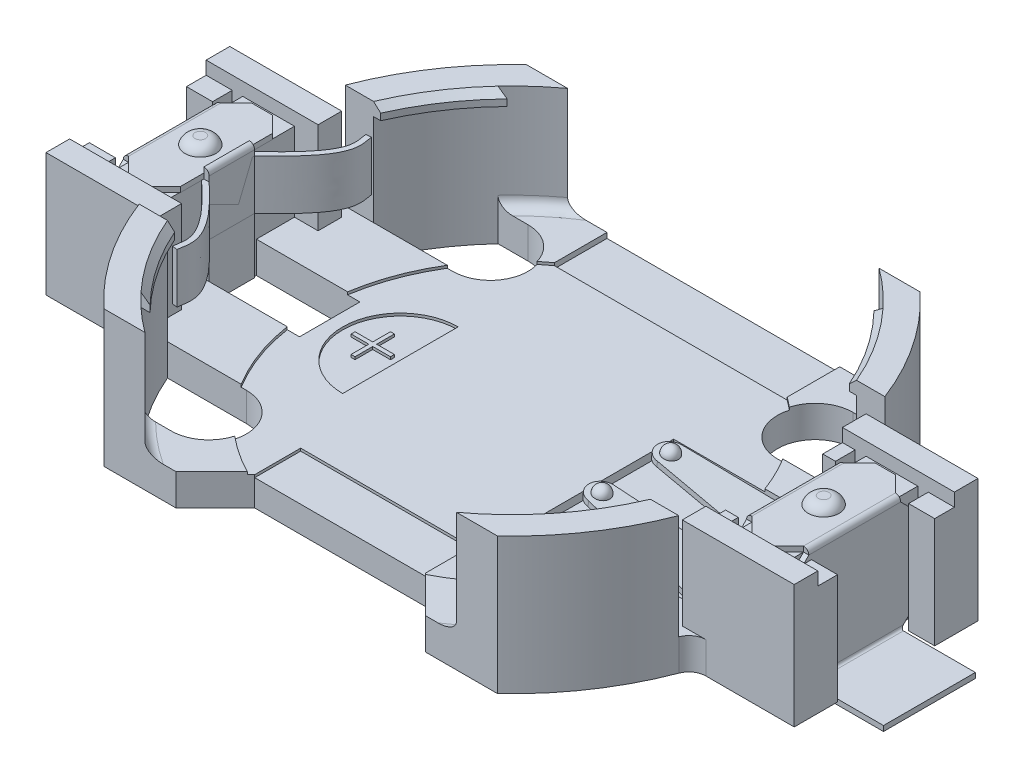
from build123d import *
from build123d.topology import SkipClean

# Parameters (mm, degrees)
EXTRUDE1_DEPTH           = 5.2
FILLET1_R                = 0.65
SKETCH2_R                = 10
CUT_EXTRUDE1_DEPTH       = 3.5
SKETCH3_R                = 9.75
CUT_EXTRUDE2_DEPTH       = 0.5
CHAMFER1_SIZE            = 0.25
FILLET2_R                = 0.4
CUT_EXTRUDE3_START       = -0.5
SKETCH4_W                = 29.959349594
SKETCH4_H                = 7.85
CUT_EXTRUDE3_DEPTH       = 0.5
CUT_EXTRUDE4_DEPTH       = 3.5
CUT_EXTRUDE5_DEPTH       = 4.7
SKETCH7_R                = 7.5
CUT_EXTRUDE6_DEPTH       = 0.1
CUT_EXTRUDE7_DEPTH       = 0.1
CUT_EXTRUDE7_DEPTH_BACK  = 0.1
SKETCH8_W                = 6.5
SKETCH8_H                = 1.75
SKETCH8_W_2              = 8.865100112
SKETCH8_H_2              = 2
SKETCH9_W                = 28.5
SKETCH9_H                = 5.2
CUT_EXTRUDE8_DEPTH       = 0.5
CUT_EXTRUDE9_START       = -4.2
CUT_EXTRUDE9_OUTLINE_W   = 3.942434783
CUT_EXTRUDE9_OUTLINE_H   = 2.3
CUT_EXTRUDE9_DEPTH       = 4.2
SKETCH11_W               = 7.32885996
SKETCH11_H               = 5.2
CUT_EXTRUDE10_DEPTH      = 0.4
SKETCH12_R               = 0.6
EXTRUDE2_DEPTH           = 0.5
FILLET3_R                = 0.4
EXTRUDE_THIN1_DEPTH      = 1.75
EXTRUDE_THIN1_DEPTH_BACK = 1.75
SKETCH16_W               = 0.484271675
SKETCH16_H               = 0.75
EXTRUDE3_DEPTH           = 3.4
EXTRUDE4_DEPTH           = 0.2
EXTRUDE5_DEPTH           = 0.2
EXTRUDE6_DEPTH           = 0.2
EXTRUDE7_DEPTH           = 0.2
CUT_EXTRUDE11_DEPTH      = 0.2
SKETCH22_R               = 0.3
EXTRUDE8_DEPTH           = 0.3
FILLET4_R                = 0.3
EXTRUDE9_DEPTH           = 0.2
EXTRUDE_THIN2_DEPTH      = 1.75
EXTRUDE_THIN2_DEPTH_BACK = 1.75
EXTRUDE_THIN3_START      = -1.9
EXTRUDE_THIN3_DEPTH      = 1.9
SKETCH26_W               = 1.729426848
SKETCH26_H               = 4.424427597
EXTRUDE10_DEPTH          = 0.2
EXTRUDE11_DEPTH          = 0.2
FILLET5_R                = 0.2
FILLET6_R                = 0.1
FILLET7_R                = 0.3


# Read off the part's stored shape, not the designer's step: Cut-Extrude9, Extrude-Thin3
# Some blends are built 0.0001 mm under size
with BuildPart() as part:
    # Sketch1 → Extrude1 (new body)
    with BuildSketch(Plane(origin=(0, 0, 0), x_dir=(1, 0, 0), z_dir=(0, 1, 0))):
        with BuildLine():
            Line((14.25, 3.5), (10.428326807, 3.5))
            ThreePointArc((10.428326807, 3.5), (9.246646511, 5.95814806), (7.496499183, 8.05))
            Line((7.496499183, 8.05), (-7.496499183, 8.05))
            ThreePointArc((-7.496499183, 8.05), (-9.246646511, 5.95814806), (-10.428326807, 3.5))
            Line((-10.428326807, 3.5), (-14.25, 3.5))
            Line((-14.25, 3.5), (-14.25, -3.5))
            Line((-14.25, -3.5), (-10.428326807, -3.5))
            ThreePointArc((-10.428326807, -3.5), (-9.246646511, -5.95814806), (-7.496499183, -8.05))
            Line((-7.496499183, -8.05), (-4.75, -8.05))
            Line((-4.75, -8.05), (-3.25, -6.55))
            Line((-3.25, -6.55), (3.25, -6.55))
            Line((3.25, -6.55), (4.75, -8.05))
            Line((4.75, -8.05), (7.496499183, -8.05))
            ThreePointArc((7.496499183, -8.05), (9.246646511, -5.95814806), (10.428326807, -3.5))
            Line((10.428326807, -3.5), (14.25, -3.5))
            Line((14.25, -3.5), (14.25, 3.5))
        make_face()
    extrude(amount=EXTRUDE1_DEPTH)

    # Fillet1
    fillet1_edges = [part.edges().sort_by_distance(p)[0] for p in [
        (-10.428326807, 2.6, 3.5),
        (-10.428326807, 2.6, -3.5),
        (10.428326807, 2.6, -3.5),
        (10.428326807, 2.6, 3.5),
    ]]
    fillet(fillet1_edges, radius=FILLET1_R)

    # Sketch2 → Cut-Extrude1 (cut)
    with BuildSketch(Plane(origin=(0, 1.2, 0), x_dir=(-1, 0, 0), z_dir=(0, 1, 0))):
        Circle(SKETCH2_R)
    extrude(amount=CUT_EXTRUDE1_DEPTH, mode=Mode.SUBTRACT)

    # Sketch3 → Cut-Extrude2 (cut)
    with BuildSketch(Plane(origin=(0, 5.2, 0), x_dir=(-1, 0, 0), z_dir=(0, 1, 0))):
        Circle(SKETCH3_R)
    extrude(amount=-CUT_EXTRUDE2_DEPTH, mode=Mode.SUBTRACT)

    # Chamfer1
    chamfer1_edges = [part.edges().sort_by_distance(p)[0] for p in [
        (-9.75, 5.2, 0),
        (9.75, 5.2, 0),
    ]]
    chamfer(chamfer1_edges, length=CHAMFER1_SIZE)

    # Fillet2
    fillet2_edges = [part.edges().sort_by_distance(p)[0] for p in [
        (10, 1.2, 0),
        (-10, 1.2, 0),
    ]]
    fillet(fillet2_edges, radius=FILLET2_R)

    # Sketch4 → Cut-Extrude3 (cut)
    with SkipClean():  # the faces are left unmerged after this step: merging them gives an invalid solid
        with BuildSketch(Plane(origin=(0, 5.2, 0), x_dir=(-1, 0, 0), z_dir=(0, 1, 0)).offset(CUT_EXTRUDE3_START)):
            with BuildLine():
                Line((5.932748098, 8.05), (-5.932748098, 8.05))
                ThreePointArc((-5.932748098, 8.05), (-6.661817604, 7.457894221), (-7.332121112, 6.8))
                Line((-7.332121112, 6.8), (7.332121112, 6.8))
                ThreePointArc((7.332121112, 6.8), (6.661817604, 7.457894221), (5.932748098, 8.05))
            make_face()
            with Locations((0.081300813, 0)):
                Rectangle(SKETCH4_W, SKETCH4_H)
            with BuildLine():
                Line((5.932748098, -8.05), (-5.932748098, -8.05))
                ThreePointArc((-5.932748098, -8.05), (-6.661817604, -7.457894221), (-7.332121112, -6.8))
                Line((-7.332121112, -6.8), (7.332121112, -6.8))
                ThreePointArc((7.332121112, -6.8), (6.661817604, -7.457894221), (5.932748098, -8.05))
            make_face()
        extrude(amount=CUT_EXTRUDE3_DEPTH, mode=Mode.SUBTRACT)

    # Sketch5 → Cut-Extrude4 (cut)
    with BuildSketch(Plane(origin=(0, 4.7, 0), x_dir=(-1, 0, 0), z_dir=(0, 1, 0))):
        Polygon((-10.885770529, 3.5), (-10.275912368, 3.925), (-8.925070028, 3.925), (8.925070028, 3.925), (10.275912368, 3.925), (10.885770529, 3.5), (9.985770529, 3.5), (9.985770529, 2.6), (10.885770529, 2.6), (10.885770529, -2.6), (9.985770529, -2.6), (9.985770529, -3.5), (10.885770529, -3.5), (10.275912368, -3.925), (8.925070028, -3.925), (-8.925070028, -3.925), (-10.275912368, -3.925), (-10.885770529, -3.5), (-9.985770529, -3.5), (-9.985770529, -2.6), (-10.885770529, -2.6), (-10.885770529, 2.6), (-9.985770529, 2.6), (-9.985770529, 3.5), align=None)
    extrude(amount=-CUT_EXTRUDE4_DEPTH, mode=Mode.SUBTRACT)

    # Sketch6 → Cut-Extrude5 (cut)
    with BuildSketch(Plane(origin=(0, 0, 0), x_dir=(1, 0, 0), z_dir=(0, 1, 0))):
        with BuildLine():
            Line((-7.332121112, -6.8), (-6.186989126, -6.8))
            ThreePointArc((-6.186989126, -6.8), (-4.749489126, -5.3625), (-6.186989126, -3.925))
            Line((-6.186989126, -3.925), (-9.197520046, -3.925))
            ThreePointArc((-9.197520046, -3.925), (-8.388901326, -5.443007858), (-7.332121112, -6.8))
        make_face()
        with BuildLine():
            Line((-7.332121112, 6.8), (-6.186989126, 6.8))
            ThreePointArc((-6.186989126, 6.8), (-4.749489126, 5.3625), (-6.186989126, 3.925))
            Line((-6.186989126, 3.925), (-9.197520046, 3.925))
            ThreePointArc((-9.197520046, 3.925), (-8.388901326, 5.443007858), (-7.332121112, 6.8))
        make_face()
        with BuildLine():
            Line((6.186989126, 3.925), (9.197520046, 3.925))
            ThreePointArc((9.197520046, 3.925), (8.388901326, 5.443007858), (7.332121112, 6.8))
            Line((7.332121112, 6.8), (6.186989126, 6.8))
            ThreePointArc((6.186989126, 6.8), (4.749489126, 5.3625), (6.186989126, 3.925))
        make_face()
        with BuildLine():
            Line((6.186989126, -3.925), (9.197520046, -3.925))
            ThreePointArc((9.197520046, -3.925), (8.388901326, -5.443007858), (7.332121112, -6.8))
            Line((7.332121112, -6.8), (6.186989126, -6.8))
            ThreePointArc((6.186989126, -6.8), (4.749489126, -5.3625), (6.186989126, -3.925))
        make_face()
    extrude(amount=CUT_EXTRUDE5_DEPTH, mode=Mode.SUBTRACT)

    # Sketch7 → Cut-Extrude6 (cut)
    with BuildSketch(Plane(origin=(0, 1.2, 0), x_dir=(-1, 0, 0), z_dir=(0, 1, 0))):
        Circle(SKETCH7_R)
    extrude(amount=-CUT_EXTRUDE6_DEPTH, mode=Mode.SUBTRACT)

    # Sketch8 → Cut-Extrude7 (cut, two sides: drawn at the far end of the back side and taken through both)
    # profile 1 of 3: a face of its own
    with BuildSketch(Plane(origin=(0, 1.1, 0), x_dir=(-1, 0, 0), z_dir=(0, 1, 0)).offset(-CUT_EXTRUDE7_DEPTH_BACK)):
        with Locations((0, 5.675)):
            Rectangle(SKETCH8_W, SKETCH8_H)
    # profile 2 of 3: a face of its own
    with BuildSketch(Plane(origin=(0, 1.1, 0), x_dir=(-1, 0, 0), z_dir=(0, 1, 0)).offset(-CUT_EXTRUDE7_DEPTH_BACK)):
        with Locations((0, -7.05)):
            Rectangle(SKETCH8_W_2, SKETCH8_H_2)
    # profile 3 of 3: a face of its own
    with BuildSketch(Plane(origin=(0, 1.1, 0), x_dir=(-1, 0, 0), z_dir=(0, 1, 0)).offset(-CUT_EXTRUDE7_DEPTH_BACK)):
        with BuildLine():
            Line((4.25, -2.2), (4.25, 2.2))
            ThreePointArc((4.25, 2.2), (6.45, 0), (4.25, -2.2))
        make_face()
        Polygon((5.380281096, 0.075), (5.380281096, 0.75), (5.230281096, 0.75), (5.230281096, 0.075), (4.552474472, 0.075), (4.552474472, -0.075), (5.230281096, -0.075), (5.230281096, -0.75), (5.380281096, -0.75), (5.380281096, -0.075), (6.052474472, -0.075), (6.052474472, 0.075), align=None, mode=Mode.SUBTRACT)
    extrude(amount=CUT_EXTRUDE7_DEPTH + CUT_EXTRUDE7_DEPTH_BACK, mode=Mode.SUBTRACT)

    # Sketch9 → Cut-Extrude8 (cut)
    with BuildSketch(Plane(origin=(0, 4.7, 0), x_dir=(-1, 0, 0), z_dir=(0, 1, 0))):
        Rectangle(SKETCH9_W, SKETCH9_H)
    extrude(amount=-CUT_EXTRUDE8_DEPTH, mode=Mode.SUBTRACT)

    # Cut-Extrude9 outline → Cut-Extrude9 (cut)
    with BuildSketch(Plane(origin=(0, 4.2, 0), x_dir=(-1, 0, 0), z_dir=(0, 1, 0)).offset(CUT_EXTRUDE9_START)):
        with Locations((8.914553138, 0)):
            Rectangle(CUT_EXTRUDE9_OUTLINE_W, CUT_EXTRUDE9_OUTLINE_H)
        Polygon((12.856094179, 2.6), (12.856094179, -2.6), (13.256094179, -2.6), (13.256094179, -1.85), (14.25, -1.85), (14.25, 1.85), (13.256094179, 1.85), (13.256094179, 2.6), align=None)
        Polygon((-12.856094179, -2.6), (-12.856094179, 2.6), (-13.256094179, 2.6), (-13.256094179, 1.85), (-14.25, 1.85), (-14.25, -1.85), (-13.256094179, -1.85), (-13.256094179, -2.6), align=None)
    extrude(amount=CUT_EXTRUDE9_DEPTH, mode=Mode.SUBTRACT)

    # Sketch11 → Cut-Extrude10 (cut)
    with BuildSketch(Plane(origin=(0, 1.2, 0), x_dir=(-1, 0, 0), z_dir=(0, 1, 0))):
        with Locations((-7.221340549, 0)):
            Rectangle(SKETCH11_W, SKETCH11_H)
    extrude(amount=-CUT_EXTRUDE10_DEPTH, mode=Mode.SUBTRACT)

    # Sketch12 → Extrude2 (add)
    with BuildSketch(Plane(origin=(0, 4.2, 0), x_dir=(-1, 0, 0), z_dir=(0, 1, 0))):
        with Locations(Location((11.870932354, 0, 0), (0, 0, 90))):
            Circle(SKETCH12_R)
        with Locations(Location((-11.870932354, 0, 0), (0, 0, 90))):
            Circle(SKETCH12_R)
    extrude(amount=EXTRUDE2_DEPTH)

    # Fillet3
    fillet3_edges = [part.edges().sort_by_distance(p)[0] for p in [
        (-11.870932354, 4.7, -0.6),
        (11.870932354, 4.7, -0.6),
    ]]
    fillet(fillet3_edges, radius=FILLET3_R)

    # Sketch14 → Extrude-Thin1 (add, two sides: drawn at the far end of the back side and taken through both)
    with BuildSketch(Plane.XY.offset(-EXTRUDE_THIN1_DEPTH_BACK)):
        Polygon((15.9, -0.2), (12.856094179, -0.2), (12.856094179, 4.2), (10.885770529, 4.2), (10.885770529, 0.8), (4.214275881, 1.725231959), (4.241749803, 1.923335931), (10.685770529, 1.029651047), (10.685770529, 4.4), (13.056094179, 4.4), (13.056094179, 0), (15.9, 0), align=None)
    extrude(amount=EXTRUDE_THIN1_DEPTH + EXTRUDE_THIN1_DEPTH_BACK)

    # Sketch16 → Extrude3 (add)
    with BuildSketch(Plane(origin=(0, 4.2, 0), x_dir=(-1, 0, 0), z_dir=(0, 1, 0))):
        with Locations((-10.227906367, -2.225)):
            Rectangle(SKETCH16_W, SKETCH16_H)
        with Locations((-10.227906367, 2.225)):
            Rectangle(SKETCH16_W, SKETCH16_H)
    extrude(amount=-EXTRUDE3_DEPTH)

    # Sketch17 → Extrude4 (add)
    with BuildSketch(Plane(origin=(13.056094179, 0, 0), x_dir=(0, 0, -1), z_dir=(1, 0, 0))):
        Polygon((-1.75, 0), (-2.35, 0.6), (-2.35, 3.6), (-1.75, 4.2), (1.75, 4.2), (2.35, 3.6), (2.35, 0.6), (1.75, 0), align=None)
    extrude(amount=-EXTRUDE4_DEPTH)

    # Sketch18 → Extrude5 (add)
    with BuildSketch(Plane.ZY.offset(-10.685770529)):
        Polygon((1.75, 1.26), (2.35, 1.86), (2.35, 3.6), (1.75, 4.2), (-1.75, 4.2), (-2.35, 3.6), (-2.35, 1.86), (-1.75, 1.26), align=None)
    extrude(amount=-EXTRUDE5_DEPTH)

    # Sketch19 → Extrude6 (add)
    with BuildSketch(Plane.ZY.offset(12.856094179)):
        Polygon((1.75, 0), (2.35, 0.6), (2.35, 3.6), (1.75, 4.2), (-1.75, 4.2), (-2.35, 3.6), (-2.35, 0.6), (-1.75, 0), align=None)
    extrude(amount=EXTRUDE6_DEPTH)

    # Sketch20 → Extrude7 (add)
    with BuildSketch(Plane(origin=(0.34174674, 2.464205356, 0), x_dir=(-0.9905198583534857, 0.13736961165916825, 0), z_dir=(0.13736961165916825, 0.9905198583534858, 0))):
        Polygon((-9.543668538, 2.492071231), (-9.543668538, -2.426661505), (-3.937329505, -1.75), (-3.937329505, 1.75), align=None)
    extrude(amount=-EXTRUDE7_DEPTH)

    # Sketch21 → Cut-Extrude11 (cut)
    with BuildSketch(Plane(origin=(0.34174674, 2.464205356, 0), x_dir=(-0.9905198583534857, 0.13736961165916825, 0), z_dir=(0.13736961165916825, 0.9905198583534858, 0))):
        with BuildLine():
            Line((-4.437329505, -0.806719193), (-9.030281511, -0.5))
            ThreePointArc((-9.030281511, -0.5), (-9.530281511, 0), (-9.030281511, 0.5))
            Line((-9.030281511, 0.5), (-4.437329505, 0.811820479))
            ThreePointArc((-4.437329505, 0.811820479), (-3.937329505, 1.311820479), (-4.437329505, 1.811820479))
            Line((-4.437329505, 1.811820479), (-4.437329505, 2.089590928))
            Line((-4.437329505, 2.089590928), (-3.686994954, 2.089590928))
            Line((-3.686994954, 2.089590928), (-3.686994954, -2.224520413))
            Line((-3.686994954, -2.224520413), (-4.437329505, -2.224520413))
            Line((-4.437329505, -2.224520413), (-4.437329505, -1.806719193))
            ThreePointArc((-4.437329505, -1.806719193), (-3.937329505, -1.306719193), (-4.437329505, -0.806719193))
        make_face()
    extrude(amount=-CUT_EXTRUDE11_DEPTH, mode=Mode.SUBTRACT)

    # Sketch22 → Extrude8 (add)
    with BuildSketch(Plane(origin=(0.34174674, 2.464205356, 0), x_dir=(-0.9905198583534857, 0.13736961165916825, 0), z_dir=(0.13736961165916825, 0.9905198583534858, 0))):
        with Locations(Location((-4.437329505, 1.311820479, 0), (0, 0, 180))):
            Circle(SKETCH22_R)
        with Locations(Location((-4.437329505, -1.306719193, 0), (0, 0, 180))):
            Circle(SKETCH22_R)
    extrude(amount=EXTRUDE8_DEPTH)

    # Fillet4
    fillet4_edges = [part.edges().sort_by_distance(p)[0] for p in [
        (4.481064659, 2.193017966, 1.311820479),
        (4.481064659, 2.193017966, -1.306719193),
    ]]
    fillet(fillet4_edges, radius=FILLET4_R - 0.0001)  # a hair under: the kernel refuses the full size

    # Sketch23 → Extrude9 (add)
    with BuildSketch(Plane(origin=(0, 4.4, 0), x_dir=(-1, 0, 0), z_dir=(0, 1, 0))):
        Polygon((-10.885770529, -1.75), (-11.485770529, -2.35), (-12.256094179, -2.35), (-12.856094179, -1.75), (-12.856094179, 1.75), (-12.256094179, 2.35), (-11.485770529, 2.35), (-10.885770529, 1.75), align=None)
    extrude(amount=-EXTRUDE9_DEPTH)

    # Sketch24 → Extrude-Thin2 (add, two sides: drawn at the far end of the back side and taken through both)
    with BuildSketch(Plane.XY.offset(-EXTRUDE_THIN2_DEPTH_BACK)):
        Polygon((-15.9, -0.2), (-12.856094179, -0.2), (-12.856094179, 4.2), (-10.87, 4.2), (-10.87, 4.4), (-13.056094179, 4.4), (-13.056094179, 0), (-15.9, 0), align=None)
    extrude(amount=EXTRUDE_THIN2_DEPTH + EXTRUDE_THIN2_DEPTH_BACK)

    # Sketch26 → Extrude10 (add)
    with BuildSketch(Plane(origin=(-10.67, 0, 0), x_dir=(0, 0, -1), z_dir=(1, 0, 0))):
        with Locations((0, 2.387786202)):
            Rectangle(SKETCH26_W, SKETCH26_H)
    extrude(amount=-EXTRUDE10_DEPTH)

    # Sketch27 → Extrude11 (add)
    with BuildSketch(Plane(origin=(0, 4.4, 0), x_dir=(-1, 0, 0), z_dir=(0, 1, 0))):
        Polygon((12.856094179, -1.75), (12.256094179, -2.35), (11.47, -2.35), (10.87, -1.75), (10.87, 1.75), (11.47, 2.35), (12.256094179, 2.35), (12.856094179, 1.75), align=None)
    extrude(amount=-EXTRUDE11_DEPTH)

    # Fillet5
    fillet5_edges = [part.edges().sort_by_distance(p)[0] for p in [
        (-13.056094179, 4.4, 0),
        (-10.67, 4.6, 0),
        (10.685770529, 1.029651047, 0),
        (13.056094179, 4.4, 0),
        (10.685770529, 4.4, 0),
    ]]
    fillet(fillet5_edges, radius=FILLET5_R - 0.0001)  # a hair under: the kernel refuses the full size

    # Fillet6
    # the kernel refuses this fillet: 0.1 mm, written as the material it adds along each edge
    with BuildSketch(Plane(origin=(13.056094179, 0, -2), x_dir=(0, 1, 0), z_dir=(0, 0, 1))) as fillet6_piece_1_section:
        with BuildLine():
            CenterArc((FILLET6_R, -FILLET6_R), FILLET6_R, 90, 90)
            Line((0, -FILLET6_R), (0, 0))
            Line((0, 0), (FILLET6_R, 0))
        make_face()
    fillet6_piece_1 = extrude(amount=3.75, mode=Mode.PRIVATE)
    fillet6_piece_1 = split(fillet6_piece_1, bisect_by=Plane(origin=(13.066741447, 0.032258846, -1.782258846), z_dir=(0, 0.7071067811865508, 0.7071067811865444)), keep=Keep.TOP, mode=Mode.PRIVATE)
    fillet6_piece_1 = split(fillet6_piece_1, bisect_by=Plane(origin=(13.066741447, 0.043011797, -1.75), z_dir=(0, 0, -1)), keep=Keep.TOP, mode=Mode.PRIVATE)
    add(fillet6_piece_1)
    with BuildSketch(Plane(origin=(13.056094179, 0, -1.75), x_dir=(0, 1, 0), z_dir=(0, 0, 1))) as fillet6_piece_2_section:
        with BuildLine():
            CenterArc((FILLET6_R, -FILLET6_R), FILLET6_R, 90, 90)
            Line((0, -FILLET6_R), (0, 0))
            Line((0, 0), (FILLET6_R, 0))
        make_face()
    fillet6_piece_2 = extrude(amount=3.5, mode=Mode.PRIVATE)
    fillet6_piece_2 = split(fillet6_piece_2, bisect_by=Plane(origin=(13.078732485, -0.863679696, 0.886320304), z_dir=(0, 0.707106781186544, -0.7071067811865511)), keep=Keep.TOP, mode=Mode.PRIVATE)
    fillet6_piece_2 = split(fillet6_piece_2, bisect_by=Plane(origin=(13.078732485, -0.863679696, -0.886320304), z_dir=(0, 0.7071067811865508, 0.7071067811865444)), keep=Keep.TOP, mode=Mode.PRIVATE)
    add(fillet6_piece_2)
    with BuildSketch(Plane(origin=(13.056094179, 0, -1.75), x_dir=(0, 1, 0), z_dir=(0, 0, 1))) as fillet6_piece_3_section:
        with BuildLine():
            CenterArc((FILLET6_R, -FILLET6_R), FILLET6_R, 90, 90)
            Line((0, -FILLET6_R), (0, 0))
            Line((0, 0), (FILLET6_R, 0))
        make_face()
    fillet6_piece_3 = extrude(amount=3.75, mode=Mode.PRIVATE)
    fillet6_piece_3 = split(fillet6_piece_3, bisect_by=Plane(origin=(13.066741447, 0.032258846, 1.782258846), z_dir=(0, 0.707106781186544, -0.7071067811865511)), keep=Keep.TOP, mode=Mode.PRIVATE)
    fillet6_piece_3 = split(fillet6_piece_3, bisect_by=Plane(origin=(13.066741447, 0.043011797, 1.75), z_dir=(0, 0, 1)), keep=Keep.TOP, mode=Mode.PRIVATE)
    add(fillet6_piece_3)
    with BuildSketch(Plane(origin=(-13.056094179, 0, -2), x_dir=(-1, 0, 0), z_dir=(0, 0, 1))) as fillet6_piece_4_section:
        with BuildLine():
            CenterArc((FILLET6_R, -FILLET6_R), FILLET6_R, 90, 90)
            Line((0, -FILLET6_R), (0, 0))
            Line((0, 0), (FILLET6_R, 0))
        make_face()
    fillet6_piece_4 = extrude(amount=3.75, mode=Mode.PRIVATE)
    fillet6_piece_4 = split(fillet6_piece_4, bisect_by=Plane(origin=(-13.066741447, 0.043011797, -1.75), z_dir=(0, 0, -1)), keep=Keep.TOP, mode=Mode.PRIVATE)
    fillet6_piece_4 = split(fillet6_piece_4, bisect_by=Plane(origin=(-13.066741447, 0.032258846, -1.782258846), z_dir=(0, 0.7071067811865508, 0.7071067811865444)), keep=Keep.TOP, mode=Mode.PRIVATE)
    add(fillet6_piece_4)
    with BuildSketch(Plane(origin=(-13.056094179, 0, -1.75), x_dir=(-1, 0, 0), z_dir=(0, 0, 1))) as fillet6_piece_5_section:
        with BuildLine():
            CenterArc((FILLET6_R, -FILLET6_R), FILLET6_R, 90, 90)
            Line((0, -FILLET6_R), (0, 0))
            Line((0, 0), (FILLET6_R, 0))
        make_face()
    fillet6_piece_5 = extrude(amount=3.5, mode=Mode.PRIVATE)
    fillet6_piece_5 = split(fillet6_piece_5, bisect_by=Plane(origin=(-13.078732485, -0.863679696, 0.886320304), z_dir=(0, 0.707106781186544, -0.7071067811865511)), keep=Keep.TOP, mode=Mode.PRIVATE)
    fillet6_piece_5 = split(fillet6_piece_5, bisect_by=Plane(origin=(-13.078732485, -0.863679696, -0.886320304), z_dir=(0, 0.7071067811865508, 0.7071067811865444)), keep=Keep.TOP, mode=Mode.PRIVATE)
    add(fillet6_piece_5)
    with BuildSketch(Plane(origin=(-13.056094179, 0, -1.75), x_dir=(-1, 0, 0), z_dir=(0, 0, 1))) as fillet6_piece_6_section:
        with BuildLine():
            CenterArc((FILLET6_R, -FILLET6_R), FILLET6_R, 90, 90)
            Line((0, -FILLET6_R), (0, 0))
            Line((0, 0), (FILLET6_R, 0))
        make_face()
    fillet6_piece_6 = extrude(amount=3.75, mode=Mode.PRIVATE)
    fillet6_piece_6 = split(fillet6_piece_6, bisect_by=Plane(origin=(-13.066741447, 0.032258846, 1.782258846), z_dir=(0, 0.707106781186544, -0.7071067811865511)), keep=Keep.TOP, mode=Mode.PRIVATE)
    fillet6_piece_6 = split(fillet6_piece_6, bisect_by=Plane(origin=(-13.066741447, 0.043011797, 1.75), z_dir=(0, 0, 1)), keep=Keep.TOP, mode=Mode.PRIVATE)
    add(fillet6_piece_6)

    # Fillet7
    # the kernel refuses this fillet: 0.3 mm, written as the material it takes off along each edge
    with BuildSketch(Plane(origin=(-12.856094179, -0.2, -2.457106781), x_dir=(-1, 0, 0), z_dir=(0, 0, 1))) as fillet7_piece_1:
        with BuildLine():
            CenterArc((0.282842712, -0.3), FILLET7_R, 90, 70.528779366)
            Line((0, -0.2), (-0.005656854, -0.198))
            ThreePointArc((-0.005656854, -0.198), (-0.006, -0.1), (-0.006, 0))
            Line((-0.006, 0), (0, 0.006))
            Line((0, 0.006), (0.282842712, 0.006))
            Line((0.282842712, 0.006), (0.282842712, 0))
        make_face()
    extrude(amount=4.914213562, mode=Mode.SUBTRACT)
    with BuildSketch(Plane(origin=(12.856094179, -0.2, 2.457106782), x_dir=(1, 0, 0), z_dir=(0, 0, -1))) as fillet7_piece_2:
        with BuildLine():
            CenterArc((0.282842713, -0.3), FILLET7_R, 90, 70.528779366)
            Line((0, -0.2), (-0.005656854, -0.198))
            ThreePointArc((-0.005656854, -0.198), (-0.006, -0.1), (-0.006, 0))
            Line((-0.006, 0), (0, 0.006))
            Line((0, 0.006), (0.282842713, 0.006))
            Line((0.282842713, 0.006), (0.282842713, 0))
        make_face()
    extrude(amount=4.914213564, mode=Mode.SUBTRACT)


with BuildPart() as body_2:
    # Extrude-Thin3 outline → Extrude-Thin3 (new body)
    with BuildSketch(Plane(origin=(0, 4.2, 0), x_dir=(-1, 0, 0), z_dir=(0, 1, 0)).offset(EXTRUDE_THIN3_START)):
        with BuildLine():
            add(Edge.make_bspline(
                [(10.67, 0.864713424), (10.173614665, 1.323435419), (9.822073079, 1.692967509), (9.323186901, 2.309551478), (9.174908051, 2.557327079), (9.007471442, 2.990485194), (8.992502714, 3.177697568), (9.010656008, 3.408676549), (9.022423035, 3.476961108), (9.043485182, 3.598735004), (9.052691323, 3.652181709), (9.056976816, 3.701808859)],
                knots=[0, 0, 0, 0, 0.25, 0.25, 0.5, 0.5, 0.75, 0.75, 0.875, 0.875, 1, 1, 1, 1], degree=3))
            Line((10.67, 0.864713424), (10.67, -0.864713424))
            add(Edge.make_bspline(
                [(9.056976816, -3.701808859), (9.052691323, -3.652181709), (9.043485182, -3.598735004), (9.022423035, -3.476961108), (9.010656008, -3.408676549), (8.992502714, -3.177697568), (9.007471442, -2.990485194), (9.174908051, -2.557327079), (9.323186901, -2.309551478), (9.822073079, -1.692967509), (10.173614665, -1.323435419), (10.67, -0.864713424)],
                knots=[0, 0, 0, 0, 0.125, 0.125, 0.25, 0.25, 0.5, 0.5, 0.75, 0.75, 1, 1, 1, 1], degree=3))
            Line((9.056976816, -3.701808859), (9.256235263, -3.684602133))
            add(Edge.make_bspline(
                [(9.256235263, -3.684602133), (9.213517121, -3.189914723), (8.831240897, -2.820931205), (10.87, -0.952460676)],
                knots=[0, 0, 0, 0, 1, 1, 1, 1], degree=3))
            Line((10.87, -0.952460676), (10.87, 0.952460676))
            add(Edge.make_bspline(
                [(10.87, 0.952460676), (8.831240897, 2.820931205), (9.213517121, 3.189914723), (9.256235263, 3.684602133)],
                knots=[0, 0, 0, 0, 1, 1, 1, 1], degree=3))
            Line((9.256235263, 3.684602133), (9.056976816, 3.701808859))
        make_face()
    extrude(amount=EXTRUDE_THIN3_DEPTH)


solid = Compound([part.part, body_2.part])
